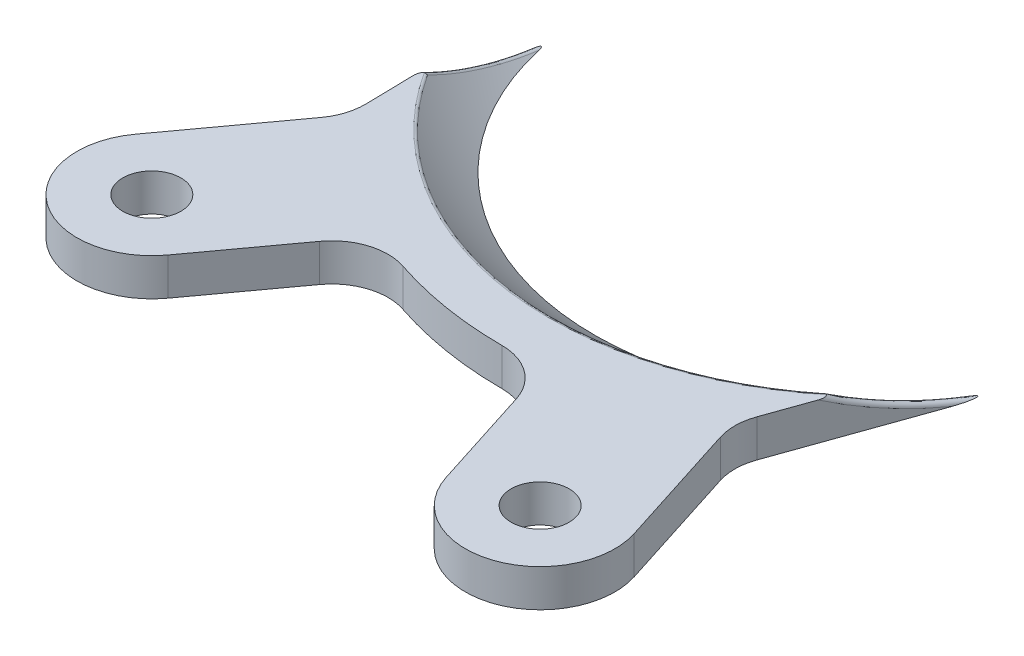
from build123d import *

# Parameters (mm, degrees)
SKETCH_1_R          = 1.55
EXTRUDE_1_DEPTH     = 2
FILLET_1_R          = 3
FILLET_2_R          = 0.2
SKETCH_3_R          = 0.75
CUT_EXTRUDE_1_DEPTH = 1


with BuildPart() as part:
    # 草图1 → 凸台-拉伸1 (new body)
    with BuildSketch(Plane(origin=(0, 0, 0), x_dir=(1, 0, 0), z_dir=(0, 1, 0))):
        with BuildLine():
            Line((-9.427629845, 12.118007633), (-14.205972572, 5.57250637))
            ThreePointArc((-14.205972572, 5.57250637), (-13.333741258, -0.01669863), (-7.744536258, 0.855532684))
            Line((-7.744536258, 0.855532684), (-2.966193531, 7.401033946))
            ThreePointArc((-2.966193531, 7.401033946), (2.156455687, 5.844533995), (7.508476858, 5.702771934))
            Line((7.508476858, 5.702771934), (9.973957748, -2.017173013))
            ThreePointArc((9.973957748, -2.017173013), (15.001264118, -4.610663069), (17.594754173, 0.416643301))
            Line((17.594754173, 0.416643301), (15.129273283, 8.136588247))
            Line((15.129273283, 8.136588247), (19.53886034, 20.548398832))
            ThreePointArc((19.53886034, 20.548398832), (2.94865648, 10.730730666), (-9.689752685, 25.287244194))
            Line((-9.689752685, 25.287244194), (-9.427629845, 12.118007633))
        make_face()
        with Locations(Location((13.784355961, -0.800264856, 0), (0, 0, 270))):
            Circle(SKETCH_1_R, mode=Mode.SUBTRACT)
        with Locations(Location((-10.975254415, 3.214019527, 0), (0, 0, 270))):
            Circle(SKETCH_1_R, mode=Mode.SUBTRACT)
    extrude(amount=EXTRUDE_1_DEPTH)

    # 圆角1
    fillet_1_edges = [part.edges().sort_by_distance(p)[0] for p in [
        (-9.427629845, 1, -12.118007633),
        (15.129273283, 1, -8.136588247),
        (7.508476858, 1, -5.702771934),
        (-2.966193531, 1, -7.401033946),
    ]]
    fillet(fillet_1_edges, radius=FILLET_1_R)

    # 草图2 → 切除-旋转1 (revolve, cut)
    with BuildSketch(Plane(origin=(5.357266973, 0, 0), x_dir=(0, -1, 0), z_dir=(-1, 0, 0))):
        with BuildLine():
            Line((5.030031962, -25.586742765), (-45.030031962, -25.586742765))
            ThreePointArc((-45.030031962, -25.586742765), (-20, -0.556710804), (5.030031962, -25.586742765))
        make_face()
    revolve(axis=Axis((5.357266973, -5.030031962, -25.586742765), (0, 1, 0)), mode=Mode.SUBTRACT)

    # 圆角2
    # the kernel refuses this fillet: 0.2 mm, written as the material it takes off along each edge
    with BuildSketch(Plane(origin=(19.53886034, 20, -20.548398832), x_dir=(0.01660114178813642, -0.9987697013737693, -0.04672778305335893), z_dir=(0.33436181166525863, 0.049589148185380114, -0.9411392539269492))) as fillet_2_piece_1:
        with BuildLine():
            CenterArc((20.396862817, 0.2), FILLET_2_R, 143.943391902, 126.056608098)
            ThreePointArc((20.235175643, 0.317716854), (20.118215024, 0.158394169), (20, 0))
            Line((20, 0), (20.396862817, 0))
        make_face()
    revolve(axis=Axis((19.53886034, 20, -20.548398832), (-0.9422985625539585, 0, -0.3347736832678813)), revolution_arc=31.526762102, mode=Mode.SUBTRACT)
    with BuildSketch(Plane(origin=(-9.689752685, 20, -25.287244194), x_dir=(0.009551792559497672, -0.8772773226727593, 0.4798888021021284), z_dir=(0.017458026871632594, 0.4799838529826972, 0.87710359603278))) as fillet_2_piece_2:
        with BuildLine():
            CenterArc((20.396862817, 0.2), FILLET_2_R, 143.943391902, 126.056608098)
            ThreePointArc((20.235175643, 0.317716854), (20.118215024, 0.158394169), (20, 0))
            Line((20, 0), (20.396862817, 0))
        make_face()
    revolve(axis=Axis((-9.689752685, 20, -25.287244194), (0.9998019706705172, 0, -0.019900237268694068)), revolution_arc=31.526762102, mode=Mode.SUBTRACT)
    with BuildSketch(Plane(origin=(5.357266973, 2, -25.586742765), x_dir=(0.6563745928876489, 0, 0.7544351488442022), z_dir=(0.7544351488442022, 0, -0.6563745928876489))) as fillet_2_piece_3:
        with BuildLine():
            CenterArc((17.473251351, 0.2), FILLET_2_R, 226.167089334, 43.832910666)
            Line((17.473251351, 0), (17.392599001, 0))
            ThreePointArc((17.392599001, 0), (17.363691769, 0.027886958), (17.334739824, 0.055727492))
        make_face()
    revolve(axis=Axis((5.357266973, 2, -25.586742765), (0, -1, 0)), revolution_arc=100.466423908, mode=Mode.SUBTRACT)

    # 草图3 → 切除-拉伸1 (cut)
    with BuildSketch(Plane.XZ):
        with Locations(Location((-8.027145861, -7.252417223, 0), (0, 0, 270))):
            Circle(SKETCH_3_R)
    extrude(amount=-CUT_EXTRUDE_1_DEPTH, mode=Mode.SUBTRACT)


solid = part.part
